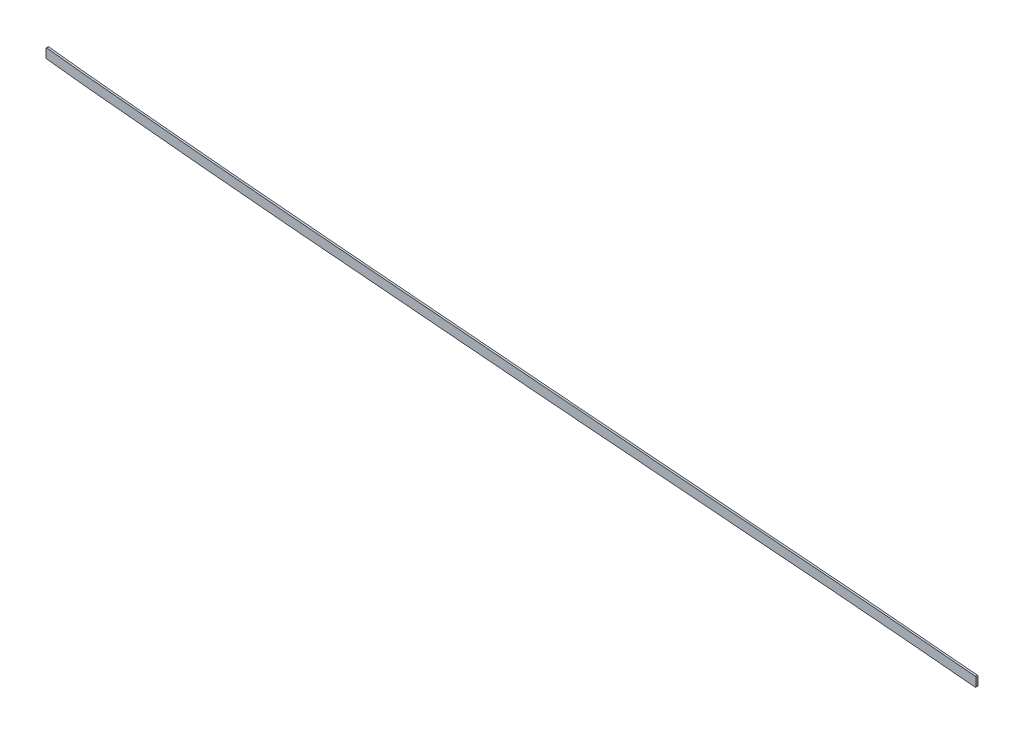
from build123d import *

# Parameters (mm, degrees)
BOSS_EXTRUDE1_DEPTH = 1.5875
FILLET1_R           = 1.27


with BuildPart() as part:
    # Sketch2 → Boss-Extrude1 (new, symmetric)
    with BuildSketch(Plane.XY):
        with BuildLine():
            add(Edge.make_bspline(
                [(825.5, 263.72872798), (833.004293944, 262.763036085), (840.535916247, 261.846014478), (848.126574562, 260.964164828), (892.90639318, 255.945629274), (937.686211733, 251.779150949), (973.452075064, 248.227669425), (1071.946672141, 239.051054038), (1170.441269319, 229.731506738), (1231.791940344, 224.503945813), (1324.899336146, 216.790627817), (1418.006730935, 209.040117978), (1449.742935921, 206.361809936), (1636.928606778, 190.521130342), (1824.114277635, 175.409157235), (1979.966947376, 164.299650253), (2139.396932204, 151.743219852), (2298.826916202, 137.00172879), (2303.011455291, 136.613290392), (2307.202438398, 136.22270903), (2311.4, 135.829939705)],
                knots=[78.681340958, 78.681340958, 78.681340958, 78.681340958, 78.681340958, 78.681340958, 82.46579272, 82.46579272, 82.46579272, 100.7932901, 100.7932901, 100.7932901, 131.0989539, 131.0989539, 131.0989539, 146.7691983, 146.7691983, 146.7691983, 223.5339586, 223.5339586, 223.5339586, 225.60075304, 225.60075304, 225.60075304, 225.60075304, 225.60075304, 225.60075304], degree=5))
            Line((825.5, 263.72872798), (825.5, 248.364439806))
            add(Edge.make_bspline(
                [(825.5, 248.364439806), (827.20768691, 248.14708351), (833.784664511, 247.321927102), (845.28106727, 245.953419483), (860.086531547, 244.295598067), (879.830703434, 242.186646028), (904.369967092, 239.698279806), (933.571022669, 236.832150625), (962.642718041, 234.023667741), (991.762593943, 231.241975908), (1021.072010315, 228.475862291), (1060.376437315, 224.796956681), (1109.513015577, 220.184378862), (1168.511190361, 214.817071985), (1227.500129793, 209.662054042), (1306.133167947, 203.021178328), (1404.361477105, 194.920725932), (1522.239851071, 184.918066624), (1640.182856491, 175.167007786), (1758.165352567, 165.757639485), (1876.155384769, 156.590937079), (1994.08749188, 147.453250142), (2092.268692061, 139.624216053), (2170.748029042, 133.079656729), (2219.771730977, 128.842227836), (2258.983988247, 125.347211495), (2286.236620906, 122.865952448), (2303.710498295, 121.243617864), (2311.4, 120.523308441)],
                knots=[78.875303138, 78.875303138, 78.875303138, 78.875303138, 79.386176103, 80.841530691, 82.29688528, 83.752239868, 86.662949044, 89.57365822, 92.484367397, 95.395076573, 98.305785749, 101.216494926, 107.037913278, 112.859331631, 118.680749984, 124.502168336, 136.145005042, 147.787841747, 159.430678452, 171.073515158, 182.716351863, 194.359188568, 206.002025273, 211.823443626, 217.644861979, 220.555571155, 223.466280331, 225.740445061, 225.740445061, 225.740445061, 225.740445061], degree=3))
            Line((2311.4, 120.523308441), (2311.4, 135.829939705))
        make_face()
    extrude(amount=BOSS_EXTRUDE1_DEPTH, both=True)

    # Fillet1
    fillet1_edges = [part.edges().sort_by_distance(p)[0] for p in [
        (2311.4, 120.523308441, -0.79375),
        (2311.4, 135.829939705, -0.79375),
        (825.5, 248.364439806, -0.79375),
        (825.5, 263.72872798, 0.79375),
    ]]
    fillet(fillet1_edges, radius=FILLET1_R)


solid = part.part
